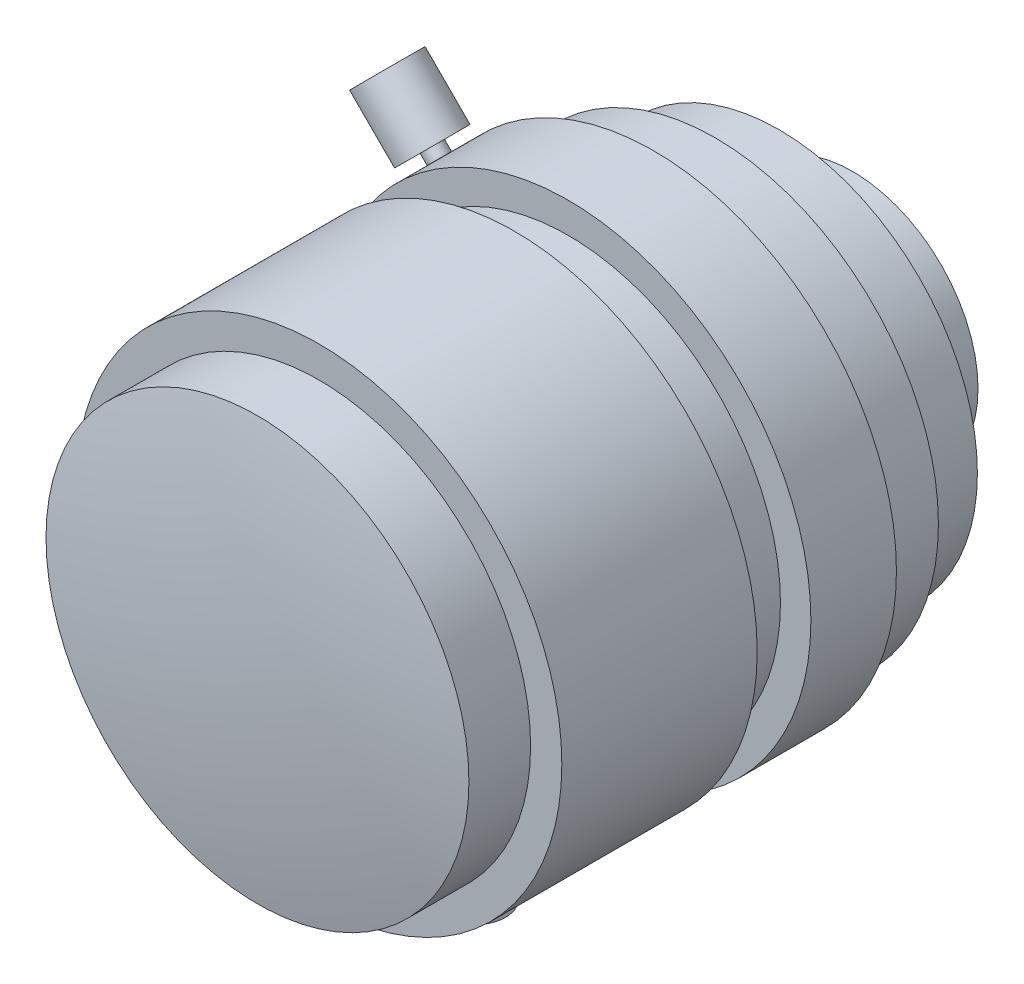
from build123d import *

# Parameters (mm, degrees)
SKETCH1_R            = 8.001
BOSS_EXTRUDE1_DEPTH  = 4.699
SKETCH2_R            = 12.6619
BOSS_EXTRUDE2_DEPTH  = 4.064
SKETCH3_R            = 14.2367
BOSS_EXTRUDE3_DEPTH  = 3.937
SKETCH4_R            = 15.494
BOSS_EXTRUDE4_DEPTH  = 5.461
SKETCH5_R            = 13.5509
BOSS_EXTRUDE5_DEPTH  = 3.429
SKETCH6_R            = 15.494
BOSS_EXTRUDE6_DEPTH  = 12.4714
SKETCH7_R            = 13.5001
BOSS_EXTRUDE7_DEPTH  = 3.937
SKETCH8_R            = 0.635
BOSS_EXTRUDE8_DEPTH  = 0.635
SKETCH9_R            = 1.9685
BOSS_EXTRUDE9_DEPTH  = 4.064
SKETCH10_R           = 0.635
BOSS_EXTRUDE10_DEPTH = 0.635
SKETCH12_R           = 1.9685
BOSS_EXTRUDE11_DEPTH = 4.064


# Read off the part's stored shape, not the designer's step: Dome1
with BuildPart() as part:
    # Sketch1 → Boss-Extrude1 (new body)
    with BuildSketch(Plane.XY):
        Circle(SKETCH1_R)
    extrude(amount=BOSS_EXTRUDE1_DEPTH)

    # Sketch2 → Boss-Extrude2 (add)
    with BuildSketch(Plane.XY.offset(4.699)):
        Circle(SKETCH2_R)
    extrude(amount=BOSS_EXTRUDE2_DEPTH)

    # Sketch3 → Boss-Extrude3 (add)
    with BuildSketch(Plane.XY.offset(8.763)):
        Circle(SKETCH3_R)
    extrude(amount=BOSS_EXTRUDE3_DEPTH)

    # Sketch4 → Boss-Extrude4 (add)
    with BuildSketch(Plane.XY.offset(12.7)):
        Circle(SKETCH4_R)
    extrude(amount=BOSS_EXTRUDE4_DEPTH)

    # Sketch5 → Boss-Extrude5 (add)
    with BuildSketch(Plane.XY.offset(18.161)):
        Circle(SKETCH5_R)
    extrude(amount=BOSS_EXTRUDE5_DEPTH)

    # Sketch6 → Boss-Extrude6 (add)
    with BuildSketch(Plane.XY.offset(21.59)):
        Circle(SKETCH6_R)
    extrude(amount=BOSS_EXTRUDE6_DEPTH)

    # Sketch7 → Boss-Extrude7 (add)
    with BuildSketch(Plane.XY.offset(34.0614)):
        Circle(SKETCH7_R)
    extrude(amount=BOSS_EXTRUDE7_DEPTH)

    # Dome1 outline → Dome1 (revolve)
    with BuildSketch(Plane.XZ):
        with BuildLine():
            Line((0, 37.9984), (13.500100071, 37.998399986))
            ThreePointArc((13.500100071, 37.998399986), (6.779852542, 38.950200635), (0, 39.2684))
            Line((0, 39.2684), (0, 37.9984))
        make_face()
    revolve(axis=Axis((0, 0, 0), (0, 0, 1)))


with BuildPart() as body_2:
    # Sketch8 → Boss-Extrude8 (new body)
    with BuildSketch(Plane(origin=(0, -15.494, 0), x_dir=(-1, 0, 0), z_dir=(0, -1, 0))):
        with Locations(Location((0, -24.13, 0), (0, 0, 90))):
            Circle(SKETCH8_R)
    extrude(amount=BOSS_EXTRUDE8_DEPTH)

    # Sketch9 → Boss-Extrude9 (add)
    with BuildSketch(Plane.XZ.offset(16.129)):
        with Locations(Location((0, 24.13, 0), (0, 0, 270))):
            Circle(SKETCH9_R)
    extrude(amount=BOSS_EXTRUDE9_DEPTH)


with BuildPart() as body_3:
    # Sketch10 → Boss-Extrude10 (new body)
    with BuildSketch(Plane(origin=(-10.955912468, 10.955912468, 0), x_dir=(0.7071067811865512, 0.7071067811865438, 0), z_dir=(-0.7071067811865438, 0.7071067811865512, 0))):
        with Locations(Location((0, -15.4305, 0), (0, 0, 180))):
            Circle(SKETCH10_R)
    extrude(amount=BOSS_EXTRUDE10_DEPTH)

    # Sketch12 → Boss-Extrude11 (add)
    with BuildSketch(Plane(origin=(-11.404925274, 11.404925274, 0), x_dir=(0, 0, 1), z_dir=(-0.7071067811865438, 0.7071067811865513, 0))):
        with Locations(Location((15.4305, 0, 0), (0, 0, 270))):
            Circle(SKETCH12_R)
    extrude(amount=BOSS_EXTRUDE11_DEPTH)


solid = Compound([part.part, body_2.part, body_3.part])
